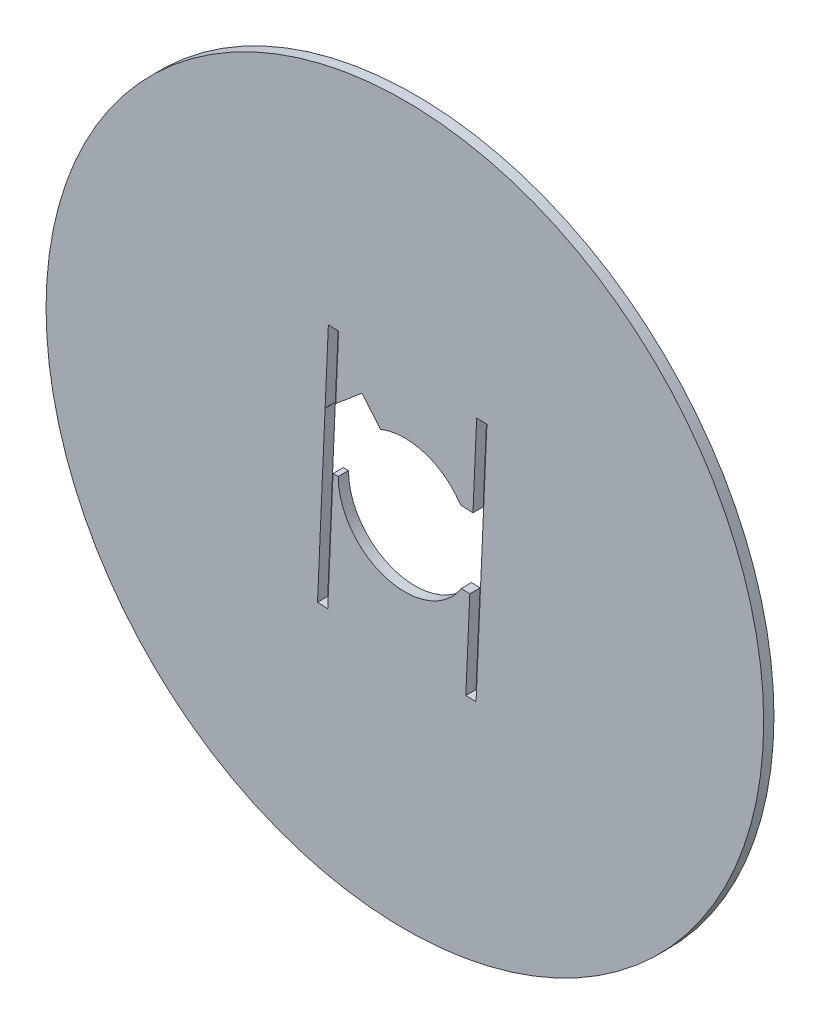
from build123d import *

# Parameters (mm, degrees)
ESQUISSE1_R        = 175
BOSS_EXTRU_1_DEPTH = 5


with BuildPart() as part:
    # Esquisse1 → Boss.-Extru.1 (new body)
    with BuildSketch(Plane.XY):
        Circle(ESQUISSE1_R)
        with BuildLine():
            Line((-20.91966999, 40.95026504), (-11.899961997, 30.243030676))
            ThreePointArc((-11.899961997, 30.243030676), (9.877796967, 30.962543937), (27.21544776, 17.764273225))
            Line((27.21544776, 17.764273225), (33.203827505, 17.5))
            Line((33.203827505, 17.5), (35.013781495, 58.513204539))
            Line((35.013781495, 58.513204539), (40.008919731, 58.292764062))
            Line((40.008919731, 58.292764062), (34.718348278, -61.590553601))
            Line((34.718348278, -61.590553601), (29.723210042, -61.370113123))
            Line((29.723210042, -61.370113123), (31.660744165, -17.465967651))
            Line((31.660744165, -17.465967651), (27.523349483, -17.283380261))
            ThreePointArc((27.523349483, -17.283380261), (-8.99280662, -31.231065129), (-32.5, 0))
            Line((-32.5, 0), (-35.034065472, 0))
            Line((-35.034065472, 0), (-37.611253378, -58.398575491))
            Line((-37.611253378, -58.398575491), (-42.606391614, -58.178135013))
            Line((-42.606391614, -58.178135013), (-38.906758812, 25.654822978))
            Line((-38.906758812, 25.654822978), (-38.97733315, 25.738601298))
            Line((-38.97733315, 25.738601298), (-38.900193886, 25.803582937))
            Line((-38.900193886, 25.803582937), (-37.315820161, 61.705182649))
            Line((-37.315820161, 61.705182649), (-32.320681925, 61.484742172))
            Line((-32.320681925, 61.484742172), (-33.702084088, 30.182438475))
            Line((-33.702084088, 30.182438475), (-20.91966999, 40.95026504))
        make_face(mode=Mode.SUBTRACT)
    extrude(amount=BOSS_EXTRU_1_DEPTH)


solid = part.part
